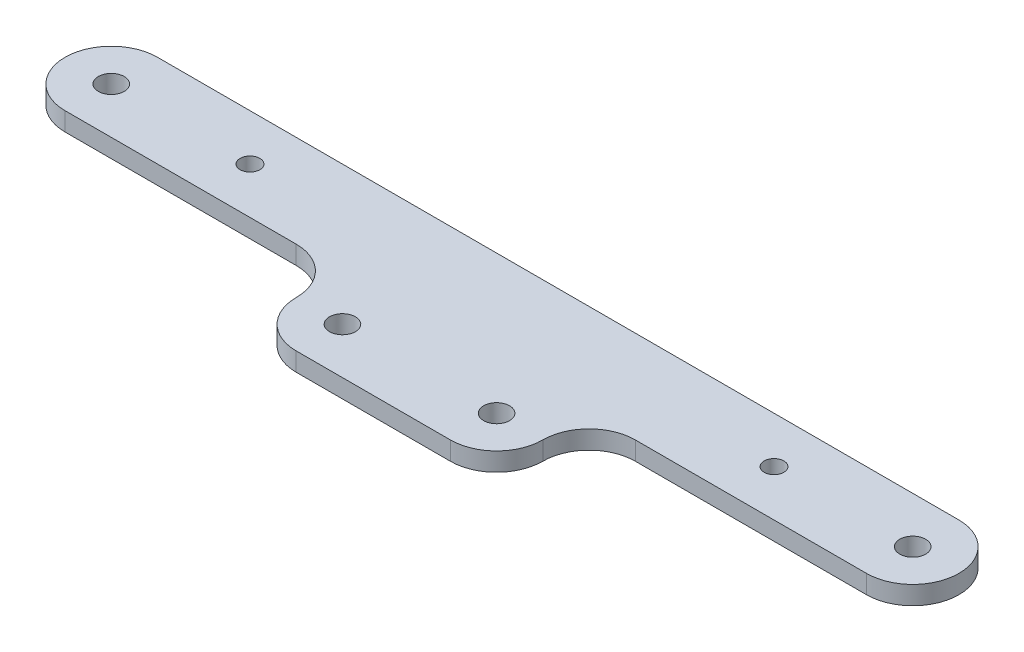
from build123d import *

# Parameters (mm, degrees)
SKETCH_1_R          = 1.6
SKETCH_1_R_2        = 2.1
EXTRUDE_1_DEPTH     = 3
SKETCH_3_W          = 40
SKETCH_3_H          = 3
EXTRUDE_3_DEPTH     = 15
SKETCH_2_R          = 2.1
CUT_EXTRUDE_1_DEPTH = 76.970388968
FILLET_START        = -1
FILLET_2_DEPTH      = 5
FILLET_2_2_DEPTH    = 3


with BuildPart() as part:
    # 草图1 → 凸台-拉伸1 (new body)
    with BuildSketch(Plane(origin=(0, 0, 0), x_dir=(1, 0, 0), z_dir=(0, 1, 0))):
        with BuildLine():
            Line((-65, 7.5), (65, 7.5))
            ThreePointArc((65, 7.5), (72.5, 0), (65, -7.5))
            Line((65, -7.5), (-65, -7.5))
            ThreePointArc((-65, -7.5), (-72.5, 0), (-65, 7.5))
        make_face()
        with Locations(Location((-42.5, 0, 0), (0, 0, 270))):
            Circle(SKETCH_1_R, mode=Mode.SUBTRACT)
        with Locations(Location((-65, 0, 0), (0, 0, 270))):
            Circle(SKETCH_1_R_2, mode=Mode.SUBTRACT)
        with Locations(Location((65, 0, 0), (0, 0, 270))):
            Circle(SKETCH_1_R_2, mode=Mode.SUBTRACT)
        with Locations(Location((42.5, 0, 0), (0, 0, 270))):
            Circle(SKETCH_1_R, mode=Mode.SUBTRACT)
    extrude(amount=EXTRUDE_1_DEPTH)

    # 草图3 → 凸台-拉伸3 (add)
    with BuildSketch(Plane.XY.offset(7.5)):
        with Locations((0, 1.5)):
            Rectangle(SKETCH_3_W, SKETCH_3_H)
    extrude(amount=EXTRUDE_3_DEPTH)

    # 草图2 → 切除-拉伸1 (cut, through all)
    with BuildSketch(Plane.XZ):
        with Locations(Location((-12.5, 15, 0), (0, 0, 270))):
            Circle(SKETCH_2_R)
        with Locations(Location((12.5, 15, 0), (0, 0, 270))):
            Circle(SKETCH_2_R)
    extrude(amount=-CUT_EXTRUDE_1_DEPTH, mode=Mode.SUBTRACT)

    # 圆角2: read off the stored shape, not the designer's step
    # 圆角2 outline → 圆角2 (cut)
    with BuildSketch(Plane(origin=(0, 0, 0), x_dir=(1, 0, 0), z_dir=(0, 1, 0)).offset(FILLET_START)):
        with BuildLine():
            ThreePointArc((20, -15), (17.803300859, -20.303300859), (12.5, -22.5))
            Line((12.5, -22.5), (20, -22.5))
            Line((20, -22.5), (20, -15))
        make_face()
        with BuildLine():
            Line((-20, -22.5), (-12.5, -22.5))
            ThreePointArc((-12.5, -22.5), (-17.803300859, -20.303300859), (-20, -15))
            Line((-20, -15), (-20, -22.5))
        make_face()
    extrude(amount=FILLET_2_DEPTH, mode=Mode.SUBTRACT)

    # Fillet 2 2 outline → Fillet 2 2 (add)
    with BuildSketch(Plane(origin=(0, 0, 0), x_dir=(1, 0, 0), z_dir=(0, 1, 0))):
        with BuildLine():
            Line((20, -7.5), (20, -15))
            ThreePointArc((20, -15), (22.196699141, -9.696699141), (27.5, -7.5))
            Line((27.5, -7.5), (20, -7.5))
        make_face()
        with BuildLine():
            ThreePointArc((-27.5, -7.5), (-22.196699141, -9.696699141), (-20, -15))
            Line((-20, -15), (-20, -7.5))
            Line((-20, -7.5), (-27.5, -7.5))
        make_face()
    extrude(amount=FILLET_2_2_DEPTH)


solid = part.part
